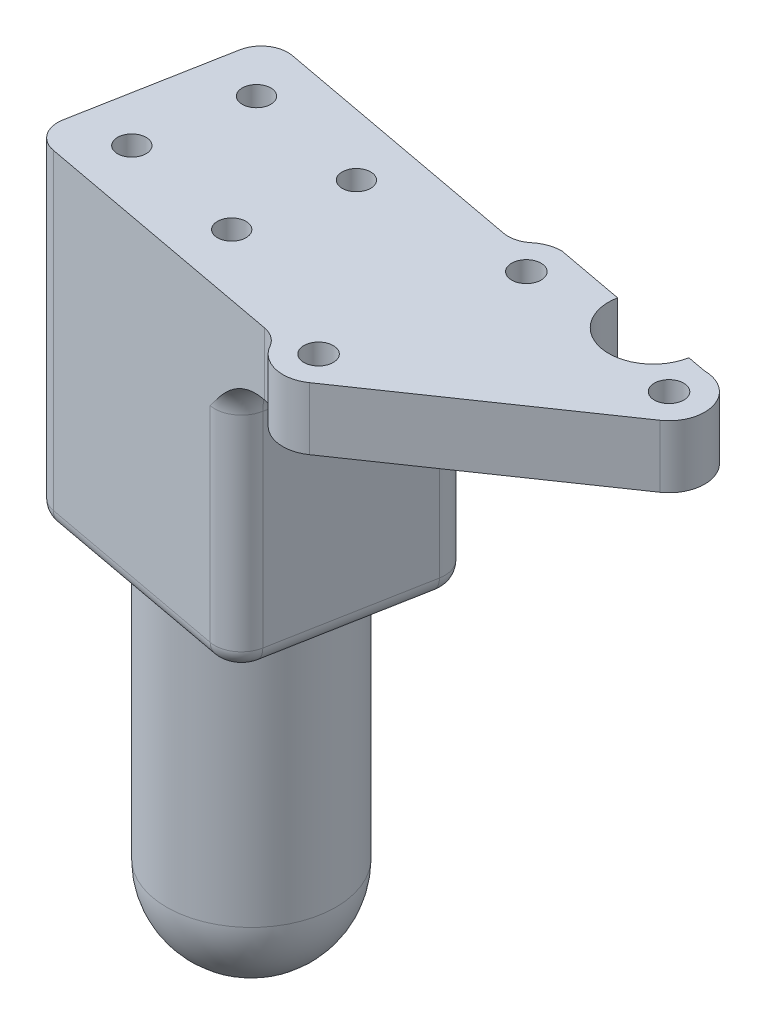
from build123d import *

# Parameters (mm, degrees)
SKETCH1_R           = 1.650000007
BOSS_EXTRUDE1_DEPTH = 3.5
BOSS_EXTRUDE3_DEPTH = 30
FILLET1_R           = 5
FILLET2_R           = 2
SKETCH4_R           = 9.5
BOSS_EXTRUDE4_DEPTH = 30
FILLET3_R           = 1
REVOLVE1_ANGLE      = 180
SKETCH6_R           = 5
CUT_EXTRUDE1_DEPTH  = 10
SKETCH7_R           = 1.6
CUT_EXTRUDE2_DEPTH  = 10


with BuildPart() as part:
    # Sketch1 → Boss-Extrude1 (new, symmetric)
    with BuildSketch(Plane(origin=(0, 0, 0), x_dir=(1, 0, 0), z_dir=(0, 1, 0))):
        with BuildLine():
            Line((-56.656859897, 90.483506167), (-36.993673105, 86.828497938))
            ThreePointArc((-36.993673105, 86.828497938), (-33.173282872, 84.013663947), (-34.729774781, 79.530807173))
            Line((-34.729774781, 79.530807173), (-58.047969803, 63.522628609))
            ThreePointArc((-58.047969803, 63.522628609), (-61.213536363, 62.923269927), (-63.79414326, 64.852132418))
            ThreePointArc((-63.79414326, 64.852132418), (-64.662572796, 65.817505246), (-65.857598376, 66.32547022))
            Line((-65.857598376, 66.32547022), (-94.996570641, 71.741844715))
            ThreePointArc((-94.996570641, 71.741844715), (-96.92158748, 72.993398991), (-97.397797425, 75.239573968))
            Line((-97.397797425, 75.239573968), (-94.29104043, 91.953282742))
            ThreePointArc((-94.29104043, 91.953282742), (-93.039486154, 93.878299581), (-90.793311177, 94.354509526))
            Line((-90.793311177, 94.354509526), (-61.654338999, 88.938135048))
            ThreePointArc((-61.654338999, 88.938135048), (-60.356600681, 88.982743171), (-59.199275822, 89.571567253))
            ThreePointArc((-59.199275822, 89.571567253), (-58.007370108, 90.248625312), (-56.656859897, 90.483506167))
        make_face()
        with Locations(Location((-56.656859897, 86.483506167, 0), (0, 0, 270))):
            Circle(SKETCH1_R, mode=Mode.SUBTRACT)
        with Locations(Location((-36.993673105, 82.828497938, 0), (0, 0, 270))):
            Circle(SKETCH1_R, mode=Mode.SUBTRACT)
        with Locations(Location((-60.311868127, 66.820319374, 0), (0, 0, 270))):
            Circle(SKETCH1_R, mode=Mode.SUBTRACT)
    extrude(amount=BOSS_EXTRUDE1_DEPTH, both=True)

    # Sketch3 → Boss-Extrude3 (add)
    with BuildSketch(Plane(origin=(0, -3.5, 0), x_dir=(1, 0, 0), z_dir=(0, 1, 0))):
        with BuildLine():
            Line((-69.163805705, 90.334000474), (-90.793311177, 94.354509526))
            ThreePointArc((-90.793311177, 94.354509526), (-93.039486154, 93.878299581), (-94.29104043, 91.953282742))
            Line((-94.29104043, 91.953282742), (-97.397797425, 75.239573968))
            ThreePointArc((-97.397797425, 75.239573968), (-96.92158748, 72.993398991), (-94.996570641, 71.741844715))
            Line((-94.996570641, 71.741844715), (-73.367065169, 67.721335662))
            ThreePointArc((-73.367065169, 67.721335662), (-71.120890192, 68.197545608), (-69.869335915, 70.122562447))
            Line((-69.869335915, 70.122562447), (-66.762578921, 86.836271221))
            ThreePointArc((-66.762578921, 86.836271221), (-67.238788866, 89.082446198), (-69.163805705, 90.334000474))
        make_face()
    extrude(amount=-BOSS_EXTRUDE3_DEPTH)

    # Fillet1
    # the kernel refuses this fillet: 5 mm, written as the material it adds along each edge
    with BuildSketch(Plane(origin=(-72.818813934, -3.5, -70.670813681), x_dir=(0.9358033400655833, 0, -0.35252249392357676), z_dir=(0.35252249392357676, 0, 0.9358033400655833))) as fillet1_piece_1_section:
        with BuildLine():
            CenterArc((3 + FILLET1_R, -FILLET1_R), FILLET1_R, 90, 90)
            Line((3 + FILLET1_R, 0), (3, 0))
            Line((3, 0), (3, -FILLET1_R))
        make_face()
    fillet1_piece_1 = revolve(axis=Axis((-72.818813934, -3.5, -70.670813681), (0, 1, 0)), revolution_arc=328.828315396, mode=Mode.PRIVATE)
    fillet1_piece_1 = split(fillet1_piece_1, bisect_by=Plane(origin=(-73.367065169, -3.5, -67.721335662), z_dir=(0.18275041146570634, 0, -0.9831593396337722)), keep=Keep.TOP, mode=Mode.PRIVATE)
    add(fillet1_piece_1)
    with BuildSketch(Plane(origin=(-69.869335915, -3.5, -70.122562447), x_dir=(0, -1, 0), z_dir=(0.18275041146570747, 0, -0.9831593396337721))) as fillet1_piece_2:
        with BuildLine():
            CenterArc((FILLET1_R, -FILLET1_R), FILLET1_R, 90, 90)
            Line((0, -FILLET1_R), (0, 0))
            Line((0, 0), (FILLET1_R, 0))
        make_face()
    extrude(amount=17)
    with BuildSketch(Plane(origin=(-69.712056939, -3.5, -87.384522455), x_dir=(0.9831593396337688, 0, 0.18275041146572465), z_dir=(-0.18275041146572465, 0, 0.9831593396337688))) as fillet1_piece_3_section:
        with BuildLine():
            CenterArc((3 + FILLET1_R, -FILLET1_R), FILLET1_R, 90, 90)
            Line((3 + FILLET1_R, 0), (3, 0))
            Line((3, 0), (3, -FILLET1_R))
        make_face()
    fillet1_piece_3 = revolve(axis=Axis((-69.712056939, -3.5, -87.384522455), (0, 1, 0)), revolution_arc=328.828315396, mode=Mode.PRIVATE)
    fillet1_piece_3 = split(fillet1_piece_3, bisect_by=Plane(origin=(-69.163805705, -3.5, -90.334000474), z_dir=(-0.1827504114659838, 0, 0.9831593396337207)), keep=Keep.TOP, mode=Mode.PRIVATE)
    add(fillet1_piece_3)

    # Fillet2
    fillet2_edges = [part.edges().sort_by_distance(p)[0] for p in [
        (-71.120890192, -33.5, -68.197545608),
        (-84.181817905, -33.5, -69.731590188),
        (-96.92158748, -33.5, -72.993398991),
        (-95.844418928, -33.5, -83.596428355),
        (-93.039486154, -33.5, -93.878299581),
        (-79.978558441, -33.5, -92.344255),
        (-67.238788866, -33.5, -89.082446198),
        (-68.315957418, -33.5, -78.479416834),
    ]]
    fillet(fillet2_edges, radius=FILLET2_R)

    # Sketch4 → Boss-Extrude4 (add)
    with BuildSketch(Plane(origin=(0, -33.5, 0), x_dir=(-1, 0, 0), z_dir=(0, -1, 0))):
        with Locations(Location((82.080188173, 81.037922594, 0), (0, 0, 280.530004657))):
            Circle(SKETCH4_R)
    extrude(amount=BOSS_EXTRUDE4_DEPTH)

    # Fillet3
    fillet3_edges = [part.edges().sort_by_distance(p)[0] for p in [
        (-72.740174433, -33.5, -79.301793759),
        (-91.420201913, -33.5, -82.77405143),
    ]]
    fillet(fillet3_edges, radius=FILLET3_R)

    # Sketch5 → Revolve1 (revolve)
    with BuildSketch(Plane(origin=(0, -63.5, 0), x_dir=(-1, 0, 0), z_dir=(0, -1, 0))):
        with BuildLine():
            Line((82.080188173, 90.537922594), (82.080188173, 71.537922594))
            ThreePointArc((82.080188173, 71.537922594), (91.580188173, 81.037922594), (82.080188173, 90.537922594))
        make_face()
    revolve(axis=Axis((-82.080188173, -63.5, -90.537922594), (0, 0, 1)), revolution_arc=REVOLVE1_ANGLE)

    # Sketch6 → Cut-Extrude1 (cut)
    with BuildSketch(Plane(origin=(0, 3.5, 0), x_dir=(1, 0, 0), z_dir=(0, 1, 0))):
        with Locations((-44.086083588, 88.146840634)):
            Circle(SKETCH6_R)
    extrude(amount=-CUT_EXTRUDE1_DEPTH, mode=Mode.SUBTRACT)

    # Sketch7 → Cut-Extrude2 (cut)
    with BuildSketch(Plane(origin=(0, 3.5, 0), x_dir=(1, 0, 0), z_dir=(0, 1, 0))):
        with Locations(Location((-88.848960421, 88.398881924, 0), (0, 0, 270))):
            Circle(SKETCH7_R)
        with Locations(Location((-91.041965359, 76.600969848, 0), (0, 0, 270))):
            Circle(SKETCH7_R)
        with Locations(Location((-75.084729666, 85.840376163, 0), (0, 0, 270))):
            Circle(SKETCH7_R)
        with Locations(Location((-77.277734604, 74.042464088, 0), (0, 0, 270))):
            Circle(SKETCH7_R)
    extrude(amount=-CUT_EXTRUDE2_DEPTH, mode=Mode.SUBTRACT)


solid = part.part
